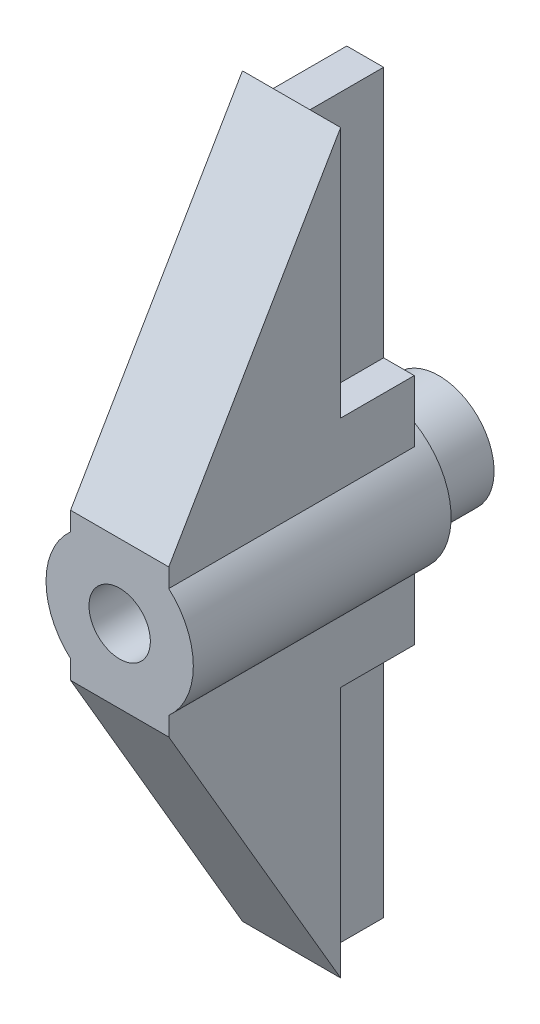
from build123d import *

# Parameters (mm, degrees)
SKETCH1_R             = 6
SKETCH1_R_2           = 2.5
BOSS_EXTRUDE1_DEPTH   = 20
BOSS_EXTRUDE2_DEPTH   = 4
SKETCH3_W             = 2.5
SKETCH3_H             = 6
CUT_EXTRUDE1_DEPTH    = 20.5
BODY_MOVE_COPY1_ANGLE = 180
BOSS_EXTRUDE3_START   = 1
SKETCH4_R             = 6
BOSS_EXTRUDE3_DEPTH   = 1
SKETCH5_R             = 4.5
BOSS_EXTRUDE4_DEPTH   = 5
SKETCH6_R             = 3.5
CUT_EXTRUDE2_DEPTH    = 5


with BuildPart() as part:
    # Sketch1 → Boss-Extrude1 (new body)
    with BuildSketch(Plane.XY):
        Circle(SKETCH1_R)
        Circle(SKETCH1_R_2, mode=Mode.SUBTRACT)
    extrude(amount=BOSS_EXTRUDE1_DEPTH)

    # Sketch2 → Boss-Extrude2 (add, symmetric)
    with BuildSketch(Plane(origin=(0, 0, 0), x_dir=(0, 0, -1), z_dir=(1, 0, 0))):
        Polygon((-20, 6), (-20, 3), (0, 3), (0, 30), (-6, 30), align=None)
    extrude(amount=BOSS_EXTRUDE2_DEPTH, both=True)

    # Sketch3 → Cut-Extrude1 (cut)
    with BuildSketch(Plane(origin=(0, 30, 0), x_dir=(1, 0, 0), z_dir=(0, 1, 0))):
        with Locations((-2.75, -3)):
            Rectangle(SKETCH3_W, SKETCH3_H)
        with Locations((2.75, -3)):
            Rectangle(SKETCH3_W, SKETCH3_H)
    extrude(amount=-CUT_EXTRUDE1_DEPTH, mode=Mode.SUBTRACT)


with BuildPart() as body_2:
    # Body-Move/Copy1: copy of part
    add(part.part.rotate(Axis((0, 0, 0), (0, 0, 1)), BODY_MOVE_COPY1_ANGLE))


with BuildPart() as part_1:
    add(part.part)

    add(body_2.part)  # Boss-Extrude3 merges body 2
    # Sketch4 → Boss-Extrude3 (add)
    with BuildSketch(Plane(origin=(0, 0, 0), x_dir=(-1, 0, 0), z_dir=(0, 0, -1)).offset(BOSS_EXTRUDE3_START)):
        Circle(SKETCH4_R)
    extrude(amount=-BOSS_EXTRUDE3_DEPTH)

    # Sketch5 → Boss-Extrude4 (add)
    with BuildSketch(Plane(origin=(0, 0, -1), x_dir=(-1, 0, 0), z_dir=(0, 0, -1))):
        Circle(SKETCH5_R)
    extrude(amount=BOSS_EXTRUDE4_DEPTH)

    # Sketch6 → Cut-Extrude2 (cut)
    with BuildSketch(Plane(origin=(0, 0, -6), x_dir=(-1, 0, 0), z_dir=(0, 0, -1))):
        Circle(SKETCH6_R)
    extrude(amount=-CUT_EXTRUDE2_DEPTH, mode=Mode.SUBTRACT)


solid = part_1.part
